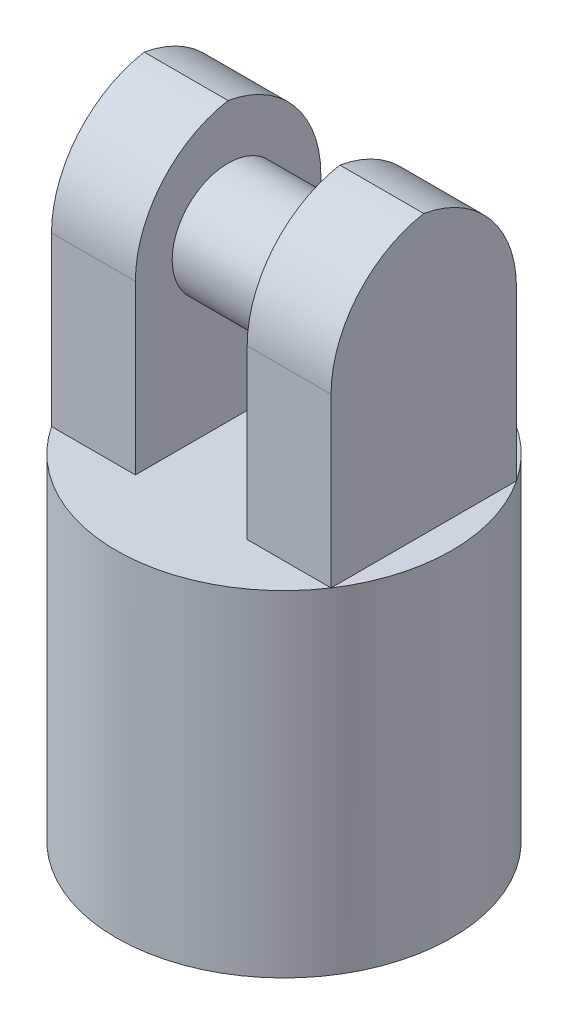
from build123d import *

# Parameters (mm, degrees)
SKETCH1_R           = 38.1
BOSS_EXTRUDE1_DEPTH = 76.2
SKETCH2_W           = 63.5
SKETCH2_H           = 42.121134838
BOSS_EXTRUDE2_DEPTH = 63.5
SKETCH3_W           = 25.4
SKETCH3_H           = 42.121134838
CUT_EXTRUDE1_DEPTH  = 63.5
FILLET1_R           = 25.4
SKETCH5_R           = 25.4
CUT_EXTRUDE3_DEPTH  = 50.8
SKETCH6_R           = 12.7
BOSS_EXTRUDE3_DEPTH = 53.34


with BuildPart() as part:
    # Sketch1 → Boss-Extrude1 (new body)
    with BuildSketch(Plane(origin=(0, 0, 0), x_dir=(1, 0, 0), z_dir=(0, 1, 0))):
        with Locations(Location((0, 0, 0), (0, 0, 90))):
            Circle(SKETCH1_R)
    extrude(amount=BOSS_EXTRUDE1_DEPTH)

    # Sketch2 → Boss-Extrude2 (add)
    with BuildSketch(Plane(origin=(0, 76.2, 0), x_dir=(1, 0, 0), z_dir=(0, 1, 0))):
        Rectangle(SKETCH2_W, SKETCH2_H)
    extrude(amount=BOSS_EXTRUDE2_DEPTH)

    # Sketch3 → Cut-Extrude1 (cut)
    with BuildSketch(Plane(origin=(0, 139.7, 0), x_dir=(1, 0, 0), z_dir=(0, 1, 0))):
        Rectangle(SKETCH3_W, SKETCH3_H)
    extrude(amount=-CUT_EXTRUDE1_DEPTH, mode=Mode.SUBTRACT)

    # Fillet1
    # the kernel refuses this fillet: 25.4 mm, written as the material it takes off along each edge
    with BuildSketch(Plane(origin=(50.8, 139.7, -21.060567419), x_dir=(0, -1, 0), z_dir=(-1, 0, 0)), Plane(origin=(-95.25, 139.7, 21.060567419), x_dir=(0, -1, 0), z_dir=(1, 0, 0)), Plane(origin=(95.25, 139.7, -21.060567419), x_dir=(0, -1, 0), z_dir=(-1, 0, 0)), Plane(origin=(-50.8, 139.7, 21.060567419), x_dir=(0, -1, 0), z_dir=(1, 0, 0))) as fillet1_piece_1:
        with BuildLine():
            CenterArc((FILLET1_R, FILLET1_R), FILLET1_R, 180, 90)
            Line((0, FILLET1_R), (0, 0))
            Line((0, 0), (FILLET1_R, 0))
        make_face()
    extrude(amount=146.05, mode=Mode.SUBTRACT)

    # Sketch5 → Cut-Extrude3 (cut)
    with BuildSketch(Plane.XZ):
        with Locations(Location((0, 0, 0), (0, 0, 270))):
            Circle(SKETCH5_R)
    extrude(amount=-CUT_EXTRUDE3_DEPTH, mode=Mode.SUBTRACT)

    # Sketch6 → Boss-Extrude3 (add)
    with BuildSketch(Plane(origin=(31.75, 0, 0), x_dir=(0, 0, -1), z_dir=(1, 0, 0))):
        with Locations((0, 114.3)):
            Circle(SKETCH6_R)
    extrude(amount=-BOSS_EXTRUDE3_DEPTH)


solid = part.part
